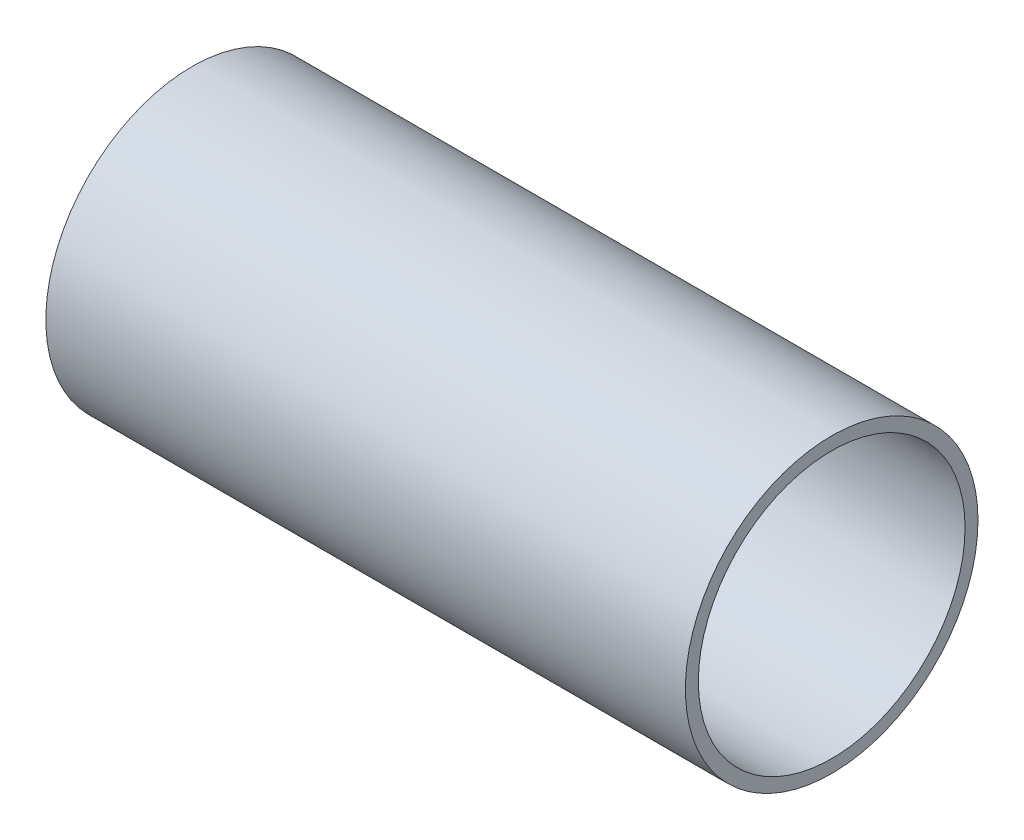
from build123d import *

# Parameters (mm, degrees)
SKIZZE1_R                       = 5.65
SKIZZE1_R_2                     = 5.15
AUFSATZ_LINEAR_AUSTRAGEN1_DEPTH = 24.7


with BuildPart() as part:
    # Skizze1 → Aufsatz-Linear austragen1 (new body)
    with BuildSketch(Plane(origin=(0, 0, 0), x_dir=(0, 0, -1), z_dir=(1, 0, 0))):
        Circle(SKIZZE1_R)
        Circle(SKIZZE1_R_2, mode=Mode.SUBTRACT)
    extrude(amount=AUFSATZ_LINEAR_AUSTRAGEN1_DEPTH)


solid = part.part
